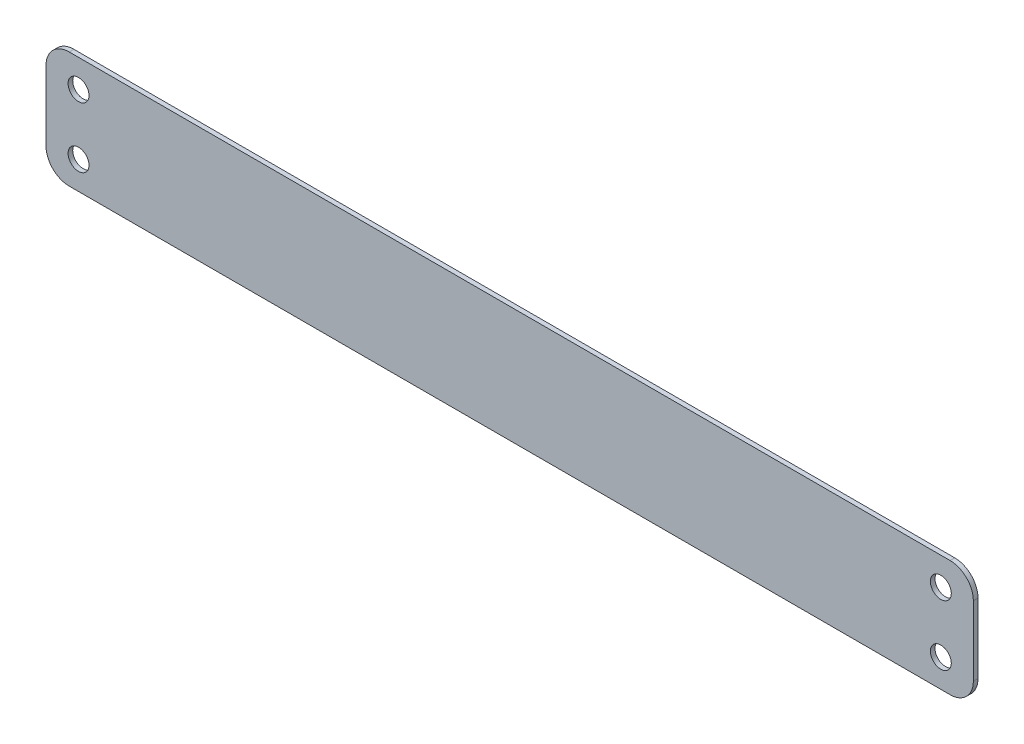
from build123d import *

# Parameters (mm, degrees)
SKETCH1_W            = 399
SKETCH1_H            = 50
BASE_FLANGE1_DEPTH   = 2
FILLET1_R            = 10
M8_CLEARANCE_HOLE1_D = 9


# Sheet-metal steps are written as plain solids
with BuildPart() as part:
    # Sketch1 → Base-Flange1 (new body)
    with BuildSketch(Plane.XY):
        Rectangle(SKETCH1_W, SKETCH1_H)
    extrude(amount=-BASE_FLANGE1_DEPTH)

    # Fillet1
    fillet1_edges = [part.edges().sort_by_distance(p)[0] for p in [
        (199.5, -25, -1),
        (-199.5, -25, -1),
        (-199.5, 25, -1),
        (199.5, 25, -1),
    ]]
    fillet(fillet1_edges, radius=FILLET1_R)

    # M8 Clearance Hole1 (through all)
    with Locations(Plane(origin=(0, 0, -2), x_dir=(-1, 0, 0), z_dir=(0, 0, -1))):
        with Locations((-185.5, 13), (-185.5, -13)):
            m8_clearance_hole1 = Hole(M8_CLEARANCE_HOLE1_D / 2)

    # Mirror1: M8 Clearance Hole1 across plane
    add(m8_clearance_hole1.mirror(Plane(origin=(0, 0, 0), x_dir=(0, 0, 1), z_dir=(1, 0, 0))), mode=Mode.SUBTRACT)


solid = part.part
